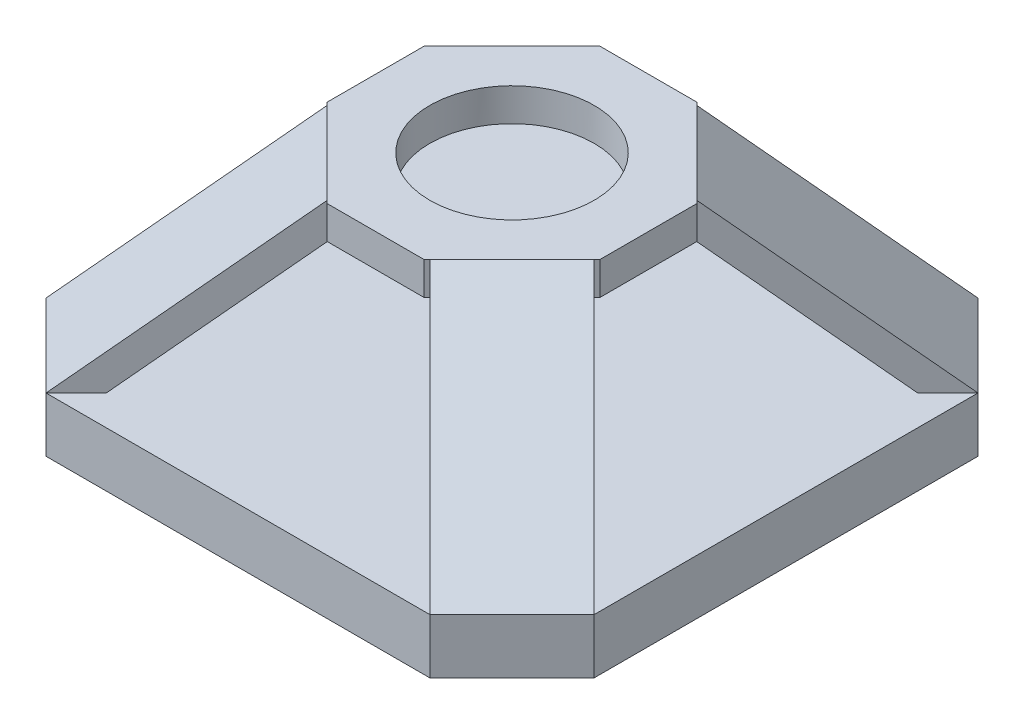
from build123d import *
from build123d.topology import SkipClean

# Parameters (mm, degrees)
SKETCH1_W               = 20
SKETCH1_H               = 20
BOSS_EXTRUDE1_DEPTH     = 2
CHAMFER1_SIZE           = 3
EXTRUDE_THIN1_DEPTH     = 14.142136
CUT_EXTRUDE1_DEPTH      = 9.899495
CIRPATTERN5_START       = -2.121320344
CIRPATTERN5_DEPTH       = 4.242640688
CIRPATTERN5_START_2     = 12.02081528
CIRPATTERN5_2_DEPTH     = 4.242640687
CIRPATTERN5_START_3     = 2.121320344
CIRPATTERN5_3_OUTLINE_W = 4.242640688
CIRPATTERN5_3_OUTLINE_H = 2
CIRPATTERN5_3_DEPTH     = 9.899494936
SKETCH7_W               = 24.04163056
SKETCH7_H               = 24.04163056
CUT_EXTRUDE2_DEPTH      = 4
BOSS_EXTRUDE2_DEPTH     = 1.2
CHAMFER5_SIZE           = 2.5
CUT_EXTRUDE3_REACH      = 31.418
SKETCH10_R              = 3


with BuildPart() as part:
    # Sketch1 → Boss-Extrude1 (new body)
    with BuildSketch(Plane(origin=(0, 0, 0), x_dir=(1, 0, 0), z_dir=(0, 1, 0))):
        with Locations((10, 10)):
            Rectangle(SKETCH1_W, SKETCH1_H)
    extrude(amount=BOSS_EXTRUDE1_DEPTH)

    # Chamfer1
    chamfer1_edges = [part.edges().sort_by_distance(p)[0] for p in [
        (0, 1, -20),
        (20, 1, -20),
        (20, 1, 0),
        (0, 1, 0),
    ]]
    chamfer(chamfer1_edges, length=CHAMFER1_SIZE)



with BuildPart() as body_2:
    # Sketch3 → Extrude-Thin1 (new body)
    with BuildSketch(Plane(origin=(-8.5, 0, -8.5), x_dir=(-0.7071067811865488, 0, 0.7071067811865464), z_dir=(-0.7071067811865464, 0, -0.7071067811865488))):
        Polygon((-2.121320344, 2), (-14.142135624, 12.086661668), (-14.784923233, 11.320617225), (-2.764107953, 1.233955557), align=None)
    extrude(amount=-EXTRUDE_THIN1_DEPTH)

    # Sketch5 → Cut-Extrude1 (cut)
    with BuildSketch(Plane(origin=(-8.5, 0, -8.5), x_dir=(-0.7071067811865488, 0, 0.7071067811865462), z_dir=(-0.7071067811865462, 0, -0.7071067811865488))):
        Polygon((-2.121320344, 2), (-14.142135624, 12.086661668), (-14.784923233, 11.320617225), (-2.764107953, 1.233955557), align=None)
    extrude(amount=-CUT_EXTRUDE1_DEPTH, mode=Mode.SUBTRACT)


with BuildPart() as part_1:
    # CirPattern5: read off the stored shape, not the designer's step
    with SkipClean():  # the faces are left unmerged after this step: merging them gives an invalid solid
        add(part.part)

        add(body_2.part)  # CirPattern5 merges body 2
        # CirPattern5 outline → CirPattern5 (add)
        with BuildSketch(Plane(origin=(0, 0, 0), x_dir=(0.707106781186549, 0, -0.707106781186546), z_dir=(0.707106781186546, 0, 0.707106781186549)).offset(CIRPATTERN5_START)):
            Polygon((14.142135624, 10.781254379), (24.607227077, 2), (26.162950904, 2), (16.263455967, 10.306662551), (14.142135624, 12.086661668), (14.784923233, 11.320617225), align=None)
        extrude(amount=CIRPATTERN5_DEPTH)

    # CirPattern5 2 outline → CirPattern5 2 (add)
    with SkipClean():  # the faces are left unmerged after this step: merging them gives an invalid solid
        with BuildSketch(Plane(origin=(0, 0, 0), x_dir=(0.7071067811865541, 0, 0.707106781186541), z_dir=(0.707106781186541, 0, -0.707106781186554)).offset(CIRPATTERN5_START_2)):
            Polygon((0, -10.781254379), (-10.465091453, -2), (-12.02081528, -2), (-2.121320344, -10.30666255), (0, -12.086661668), (2.121320344, -10.30666255), (12.02081528, -2), (10.465091453, -2), align=None)
        extrude(amount=CIRPATTERN5_2_DEPTH)

    # CirPattern5 3 outline → CirPattern5 3 (add)
    with SkipClean():  # the faces are left unmerged after this step: merging them gives an invalid solid
        with BuildSketch(Plane(origin=(0, 0, 0), x_dir=(0.7071067811865541, 0, 0.707106781186541), z_dir=(0.707106781186541, 0, -0.707106781186554)).offset(CIRPATTERN5_START_3)):
            with Locations((0, -1)):
                Rectangle(CIRPATTERN5_3_OUTLINE_W, CIRPATTERN5_3_OUTLINE_H)
        extrude(amount=CIRPATTERN5_3_DEPTH)

    # Sketch7 → Cut-Extrude2 (cut)
    with BuildSketch(Plane(origin=(0, 12.086661668, 0), x_dir=(-0.7071067811865464, 0, -0.7071067811865488), z_dir=(0, 1, 0))):
        with Locations((0, -14.142135624)):
            Rectangle(SKETCH7_W, SKETCH7_H)
    extrude(amount=-CUT_EXTRUDE2_DEPTH, mode=Mode.SUBTRACT)

    # Sketch9 → Boss-Extrude2 (add)
    with BuildSketch(Plane(origin=(0, 8.086661668, 0), x_dir=(1, 0, 0), z_dir=(0, 1, 0))):
        Polygon((10, 16.741576375), (3.258423625, 10), (10, 3.258423625), (16.741576375, 10), align=None)
    extrude(amount=-BOSS_EXTRUDE2_DEPTH)

    # Chamfer5
    chamfer5_edges = [part_1.edges().sort_by_distance(p)[0] for p in [
        (10, 7.486661668, -3.258423625),
        (10, 7.486661668, -16.741576375),
        (16.741576375, 7.486661668, -10),
        (3.258423625, 7.486661668, -10),
    ]]
    chamfer(chamfer5_edges, length=CHAMFER5_SIZE)

    # Sketch10 → Cut-Extrude3 (cut, up to next)
    with BuildSketch(Plane(origin=(0, 8.086661668, 0), x_dir=(1, 0, 0), z_dir=(0, 1, 0)), mode=Mode.PRIVATE) as cut_extrude3_sk1:
        with Locations(Location((10, 10, 0), (0, 0, 270))):
            Circle(SKETCH10_R)
    cut_extrude3_tool1 = extrude(cut_extrude3_sk1.sketch, amount=-CUT_EXTRUDE3_REACH, mode=Mode.PRIVATE) & part_1.part
    add(cut_extrude3_tool1.solids().sort_by_distance((10, 8.086662, -10))[0], mode=Mode.SUBTRACT)


solid = part_1.part
